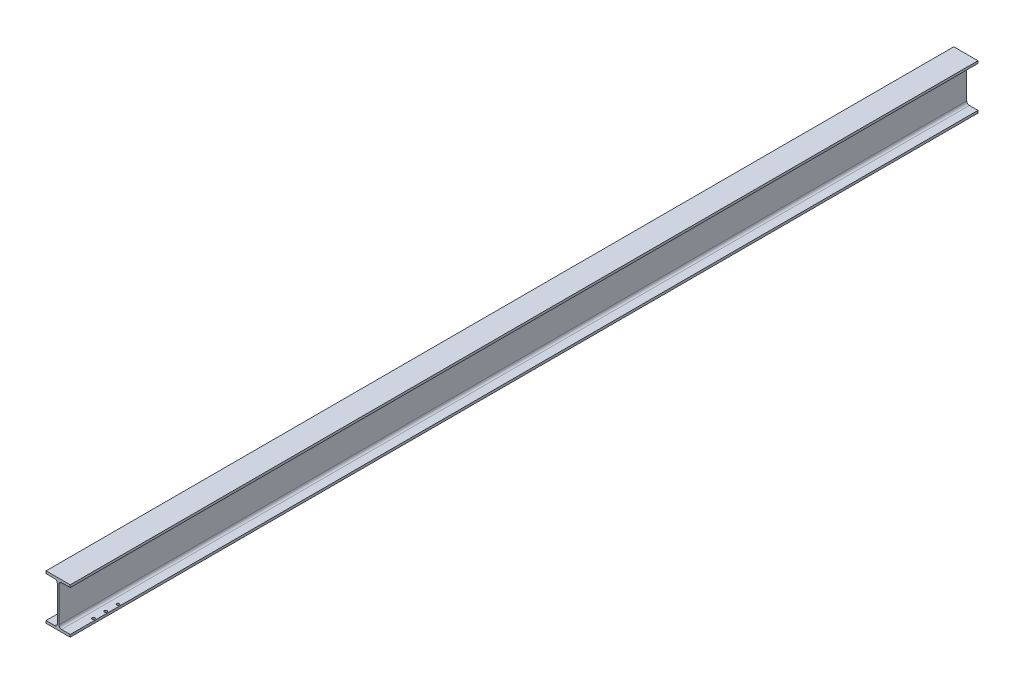
from build123d import *

# Parameters (mm, degrees)
BOSS_EXTRUDE1_DEPTH      = 1200
MIRROR1_START            = -60
MIRROR1_OUTLINE_W        = 2.2
MIRROR1_OUTLINE_H        = 2400
MIRROR1_DEPTH            = 120
MIRROR1_2_OUTLINE_W      = 29.8
MIRROR1_2_OUTLINE_H      = 2400
MIRROR1_2_DEPTH          = 6.3
MIRROR1_START_2          = 53.7
MIRROR1_3_OUTLINE_W      = 29.8
MIRROR1_3_OUTLINE_H      = 2400
MIRROR1_3_DEPTH          = 6.3
FILLET1_R                = 7
M6_CLEARANCE_HOLE1_D     = 7
M6_CLEARANCE_HOLE1_DEPTH = 6.3
LPATTERN1_COUNT          = 3
LPATTERN1_PITCH          = 32.5
LPATTERN1_COUNT_DIR2     = 2
LPATTERN1_PITCH_DIR2     = 52


# Read off the part's stored shape, not the designer's step: Mirror1
with BuildPart() as part:
    # Sketch1 → Boss-Extrude1 (new, symmetric)
    with BuildSketch(Plane.XY):
        Polygon((0, 60), (0, -60), (-32, -60), (-32, -53.7), (-2.2, -53.7), (-2.2, 53.7), (-32, 53.7), (-32, 60), align=None)
    extrude(amount=BOSS_EXTRUDE1_DEPTH, both=True)

    # Mirror1 outline → Mirror1 (add)
    with BuildSketch(Plane(origin=(0, 0, 0), x_dir=(1, 0, 0), z_dir=(0, 1, 0)).offset(MIRROR1_START)):
        with Locations((1.1, 0)):
            Rectangle(MIRROR1_OUTLINE_W, MIRROR1_OUTLINE_H)
    extrude(amount=MIRROR1_DEPTH)

    # Mirror1 2 outline → Mirror1 2 (add)
    with BuildSketch(Plane(origin=(0, 0, 0), x_dir=(1, 0, 0), z_dir=(0, 1, 0)).offset(MIRROR1_START)):
        with Locations((17.1, 0)):
            Rectangle(MIRROR1_2_OUTLINE_W, MIRROR1_2_OUTLINE_H)
    extrude(amount=MIRROR1_2_DEPTH)

    # Mirror1 3 outline → Mirror1 3 (add)
    with BuildSketch(Plane(origin=(0, 0, 0), x_dir=(1, 0, 0), z_dir=(0, 1, 0)).offset(MIRROR1_START_2)):
        with Locations((17.1, 0)):
            Rectangle(MIRROR1_3_OUTLINE_W, MIRROR1_3_OUTLINE_H)
    extrude(amount=MIRROR1_3_DEPTH)

    # Fillet1
    fillet1_edges = [part.edges().sort_by_distance(p)[0] for p in [
        (-2.2, -53.7, 0),
        (-2.2, 53.7, 0),
        (2.2, -53.7, 0),
        (2.2, 53.7, 0),
    ]]
    fillet(fillet1_edges, radius=FILLET1_R)

    # M6 Clearance Hole1
    with Locations(Plane(origin=(0, -60, 0), x_dir=(-1, 0, 0), z_dir=(0, -1, 0))):
        with Locations((-26, -1132.5)):
            m6_clearance_hole1 = Hole(M6_CLEARANCE_HOLE1_D / 2, depth=M6_CLEARANCE_HOLE1_DEPTH)

    # LPattern1: M6 Clearance Hole1 3 × 2
    with Locations(*[(-j * LPATTERN1_PITCH_DIR2, 0, -i * LPATTERN1_PITCH) for i in range(LPATTERN1_COUNT) for j in range(LPATTERN1_COUNT_DIR2) if (i, j) != (0, 0)]):
        add(m6_clearance_hole1, mode=Mode.SUBTRACT)


solid = part.part
